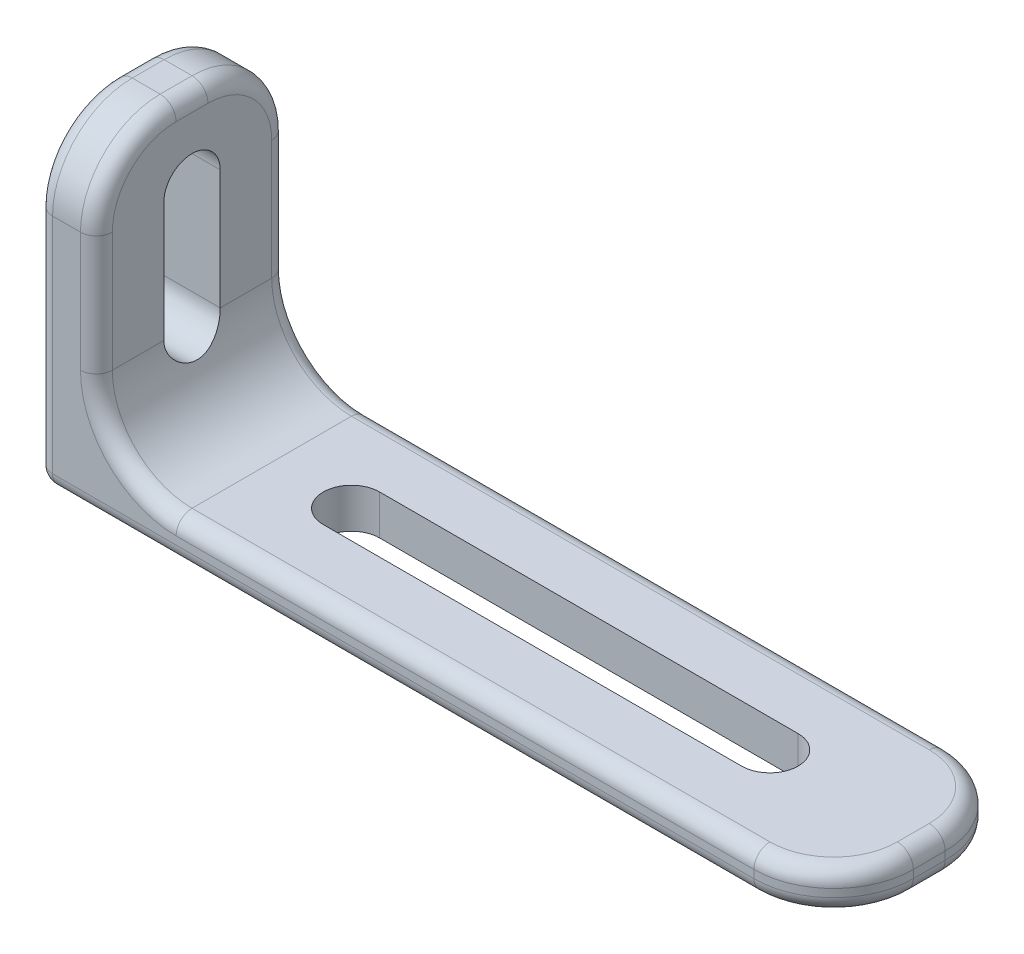
from build123d import *

# Parameters (mm, degrees)
ESQUISSE1_W                  = 58.7375
ESQUISSE1_H                  = 15.24
BOSS_EXTRU_1_DEPTH           = 3.175
ESQUISSE1_3_W                = 4.7625
ESQUISSE1_3_H                = 15.24
BOSS_EXTRU_2_DEPTH           = 25.4
ENL_V_MAT_EXTRU_1_DEPTH      = 69.814783295
ENL_V_MAT_EXTRU_1_DEPTH_BACK = 69.814783295
CONG_1_R                     = 6.35
CONG_2_R                     = 1.27


with BuildPart() as part:
    # Esquisse1 → Boss.-Extru.1 (new body)
    with BuildSketch(Plane(origin=(0, 0, 0), x_dir=(1, 0, 0), z_dir=(0, 1, 0))):
        with Locations((2.38125, 0)):
            Rectangle(ESQUISSE1_W, ESQUISSE1_H)
        with BuildLine():
            ThreePointArc((19.05, 2.2479), (21.2979, 0), (19.05, -2.2479))
            Line((19.05, -2.2479), (-14.2875, -2.2479))
            ThreePointArc((-14.2875, -2.2479), (-16.5354, 0), (-14.2875, 2.2479))
            Line((-14.2875, 2.2479), (19.05, 2.2479))
        make_face(mode=Mode.SUBTRACT)
    extrude(amount=BOSS_EXTRU_1_DEPTH)

    # Esquisse1<3> → Boss.-Extru.2 (add)
    with BuildSketch(Plane(origin=(0, 0, 0), x_dir=(1, 0, 0), z_dir=(0, 1, 0))):
        with Locations((-29.36875, 0)):
            Rectangle(ESQUISSE1_3_W, ESQUISSE1_3_H)
    extrude(amount=BOSS_EXTRU_2_DEPTH)

    # Esquisse3 → Enlèv. mat.-Extru.1 (cut, two sides: drawn at the far end of the back side and taken through both)
    with BuildSketch(Plane.ZY.offset(31.75).offset(-ENL_V_MAT_EXTRU_1_DEPTH_BACK)):
        with BuildLine():
            Line((2.2479, 19.05), (2.2479, 9.525))
            ThreePointArc((2.2479, 9.525), (0, 7.2771), (-2.2479, 9.525))
            Line((-2.2479, 9.525), (-2.2479, 19.05))
            ThreePointArc((-2.2479, 19.05), (0, 21.2979), (2.2479, 19.05))
        make_face()
    extrude(amount=ENL_V_MAT_EXTRU_1_DEPTH + ENL_V_MAT_EXTRU_1_DEPTH_BACK, mode=Mode.SUBTRACT)

    # Congé1
    # the kernel refuses this fillet: 6.35 mm, written as the material it adds along each edge
    with BuildSketch(Plane(origin=(-26.9875, 3.175, -7.62), x_dir=(1, 0, 0), z_dir=(0, 0, 1))) as cong_1_piece_1_section:
        with BuildLine():
            CenterArc((CONG_1_R, CONG_1_R), CONG_1_R, 180, 90)
            Line((0, CONG_1_R), (0, 0))
            Line((0, 0), (CONG_1_R, 0))
        make_face()
    cong_1_piece_1 = extrude(amount=15.24, mode=Mode.PRIVATE)
    cong_1_piece_1 = cong_1_piece_1 - Plane(origin=(-25.549891024, 9.525, 0), x_dir=(0, 0, 1), z_dir=(1, 0, 0)) * Cylinder(2.2479, 56, mode=Mode.PRIVATE)
    add(cong_1_piece_1)
    # the kernel refuses this fillet: 6.35 mm, written as the material it takes off along each edge
    with BuildSketch(Plane(origin=(31.75, -15.875, 7.62), x_dir=(0, 0, -1), z_dir=(0, 1, 0)), Plane(origin=(31.75, -15.875, -7.62), x_dir=(-1, 0, 0), z_dir=(0, 1, 0))) as cong_1_2_piece_1:
        with BuildLine():
            CenterArc((CONG_1_R, CONG_1_R), CONG_1_R, 180, 90)
            Line((0, CONG_1_R), (0, 0))
            Line((0, 0), (CONG_1_R, 0))
        make_face()
    extrude(amount=34.925, mode=Mode.SUBTRACT)
    with BuildSketch(Plane(origin=(-11.1125, 25.4, -7.62), x_dir=(0, -1, 0), z_dir=(-1, 0, 0))) as cong_1_2_piece_2:
        with BuildLine():
            CenterArc((CONG_1_R, CONG_1_R), CONG_1_R, 180, 90)
            Line((0, CONG_1_R), (0, 0))
            Line((0, 0), (CONG_1_R, 0))
        make_face()
    extrude(amount=36.5125, mode=Mode.SUBTRACT)
    with BuildSketch(Plane(origin=(-47.625, 25.4, 7.62), x_dir=(0, 0, -1), z_dir=(1, 0, 0))) as cong_1_2_piece_3:
        with BuildLine():
            CenterArc((CONG_1_R, -CONG_1_R), CONG_1_R, 90, 90)
            Line((0, -CONG_1_R), (0, 0))
            Line((0, 0), (CONG_1_R, 0))
        make_face()
    extrude(amount=36.5125, mode=Mode.SUBTRACT)

    # Congé2
    cong_2_edges = [part.edges().sort_by_distance(p)[0] for p in [
        (-3.175, 0, -7.62),
        (-3.175, 0, 7.62),
        (-31.75, 0, 0),
        (2.38125, 3.175, 7.62),
        (31.75, 3.175, 0),
        (2.38125, 3.175, -7.62),
        (29.890128061, 3.175, -5.760128061),
        (29.890128061, 3.175, 5.760128061),
        (-26.9875, 14.2875, -7.62),
        (-26.9875, 25.4, 0),
        (-26.9875, 14.2875, 7.62),
        (-26.9875, 23.540128061, 5.760128061),
        (-26.9875, 23.540128061, -5.760128061),
        (31.75, 0, 0),
        (29.890128061, 0, -5.760128061),
        (29.890128061, 0, 5.760128061),
        (-31.75, 9.525, 7.62),
        (-31.75, 9.525, -7.62),
        (-31.75, 25.4, 0),
        (-31.75, 23.540128061, 5.760128061),
        (-31.75, 23.540128061, -5.760128061),
        (-25.127628061, 5.034871939, 7.62),
        (-25.127628061, 5.034871939, -7.62),
    ]]
    fillet(cong_2_edges, radius=CONG_2_R)


solid = part.part
